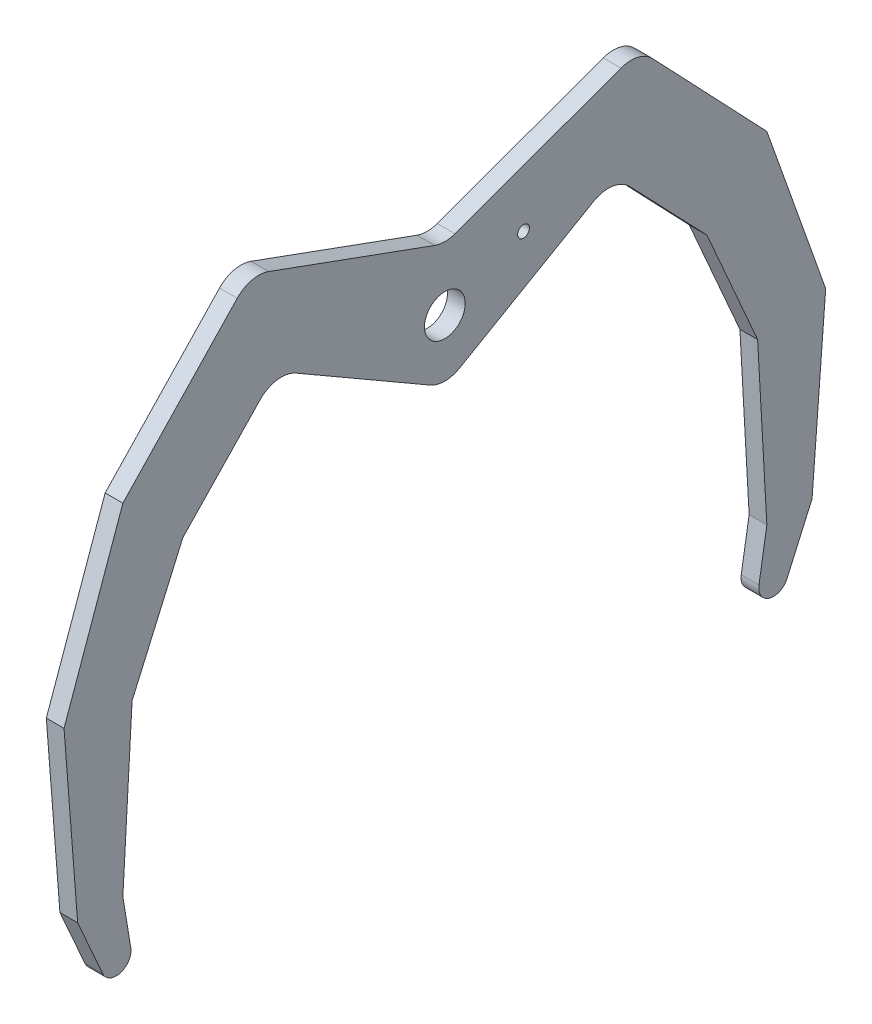
from build123d import *

# Parameters (mm, degrees)
SKETCH1_R           = 3.45
SKETCH1_R_2         = 1
BOSS_EXTRUDE1_DEPTH = 3


with BuildPart() as part:
    # Sketch1 → Boss-Extrude1 (new body)
    with BuildSketch(Plane(origin=(0, 0, 0), x_dir=(0, 0, -1), z_dir=(1, 0, 0))):
        with BuildLine():
            Line((1.710100717, 11.072425758), (29.81221294, 21.300758128))
            ThreePointArc((29.81221294, 21.300758128), (32.665838041, 21.469774041), (35.145679665, 20.04775853))
            Line((35.145679665, 20.04775853), (54.503522355, -0.309603856))
            Line((54.503522355, -0.309603856), (64.462541824, -28.342275903))
            Line((64.462541824, -28.342275903), (62.158643896, -58.002094263))
            Line((62.158643896, -58.002094263), (57.918218143, -67.574774191))
            ThreePointArc((57.918218143, -67.574774191), (54.918016136, -68.957985447), (53.165427908, -66.157464075))
            Line((53.165427908, -66.157464075), (54.503522355, -58.002094263))
            Line((54.503522355, -58.002094263), (52.939962821, -30.04554677))
            Line((52.939962821, -30.04554677), (44.360806264, -10.45))
            Line((44.360806264, -10.45), (31.292334945, 3.213047447))
            ThreePointArc((31.292334945, 3.213047447), (28.386766522, 4.706668614), (25.179055571, 4.087134512))
            Line((25.179055571, 4.087134512), (2.5, -9.006624327))
            ThreePointArc((2.5, -9.006624327), (0, -9.676497308), (-2.5, -9.006624327))
            Line((-2.5, -9.006624327), (-25.179055571, 4.087134512))
            ThreePointArc((-25.179055571, 4.087134512), (-28.386766522, 4.706668614), (-31.292334945, 3.213047447))
            Line((-31.292334945, 3.213047447), (-44.360806264, -10.45))
            Line((-44.360806264, -10.45), (-52.939962821, -30.04554677))
            Line((-52.939962821, -30.04554677), (-54.503522355, -58.002094263))
            Line((-54.503522355, -58.002094263), (-53.165427908, -66.157464075))
            ThreePointArc((-53.165427908, -66.157464075), (-54.918016136, -68.957985447), (-57.918218143, -67.574774191))
            Line((-57.918218143, -67.574774191), (-62.158643896, -58.002094263))
            Line((-62.158643896, -58.002094263), (-64.462541824, -28.342275903))
            Line((-64.462541824, -28.342275903), (-54.503522355, -0.309603856))
            Line((-54.503522355, -0.309603856), (-35.145679665, 20.04775853))
            ThreePointArc((-35.145679665, 20.04775853), (-32.665838041, 21.469774041), (-29.81221294, 21.300758128))
            Line((-29.81221294, 21.300758128), (-1.710100717, 11.072425758))
            ThreePointArc((-1.710100717, 11.072425758), (0, 10.770888862), (1.710100717, 11.072425758))
        make_face()
        Circle(SKETCH1_R, mode=Mode.SUBTRACT)
        with Locations((13.310356384, 5.624670029)):
            Circle(SKETCH1_R_2, mode=Mode.SUBTRACT)
    extrude(amount=BOSS_EXTRUDE1_DEPTH)


solid = part.part
